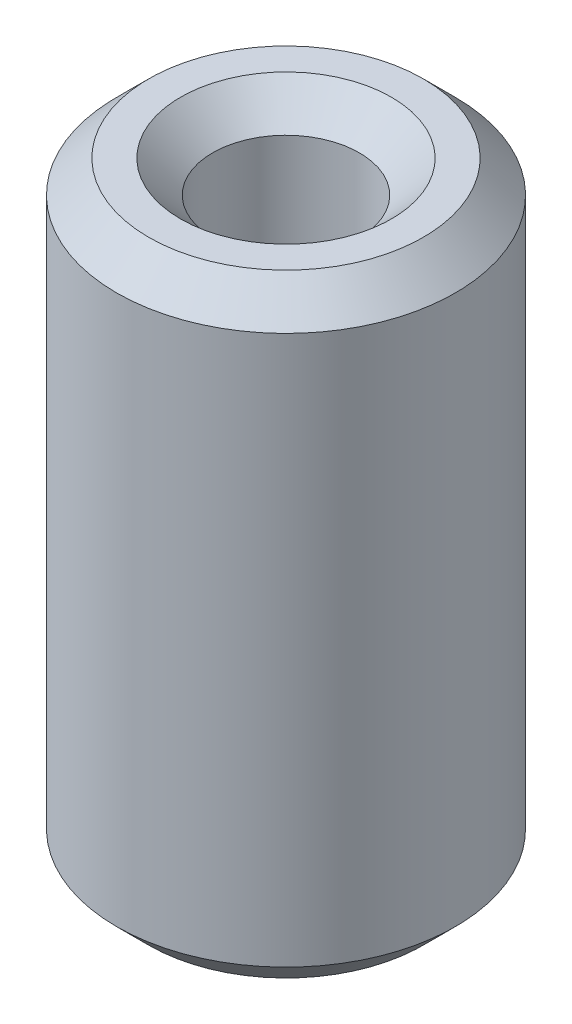
from build123d import *

# Parameters (mm, degrees)
SKETCH1_R           = 17.5
BOSS_EXTRUDE1_DEPTH = 63.333488953
SKETCH2_R           = 7.580939474
CUT_EXTRUDE1_DEPTH  = 68.997285409
CHAMFER1_SIZE       = 3.316256181


with BuildPart() as part:
    # Sketch1 → Boss-Extrude1 (new body)
    with BuildSketch(Plane(origin=(0, 0, 0), x_dir=(1, 0, 0), z_dir=(0, 1, 0))):
        Circle(SKETCH1_R)
    extrude(amount=BOSS_EXTRUDE1_DEPTH)

    # Sketch2 → Cut-Extrude1 (cut, through all)
    with BuildSketch(Plane(origin=(0, 0, 0), x_dir=(1, 0, 0), z_dir=(0, 1, 0))):
        Circle(SKETCH2_R)
    extrude(amount=CUT_EXTRUDE1_DEPTH, mode=Mode.SUBTRACT)

    # Chamfer1
    chamfer1_edges = [part.edges().sort_by_distance(p)[0] for p in [
        (-7.580939474, 63.333488953, 0),
        (-7.580939474, 0, 0),
        (-17.5, 0, 0),
        (-17.5, 63.333488953, 0),
    ]]
    chamfer(chamfer1_edges, length=CHAMFER1_SIZE)


solid = part.part
